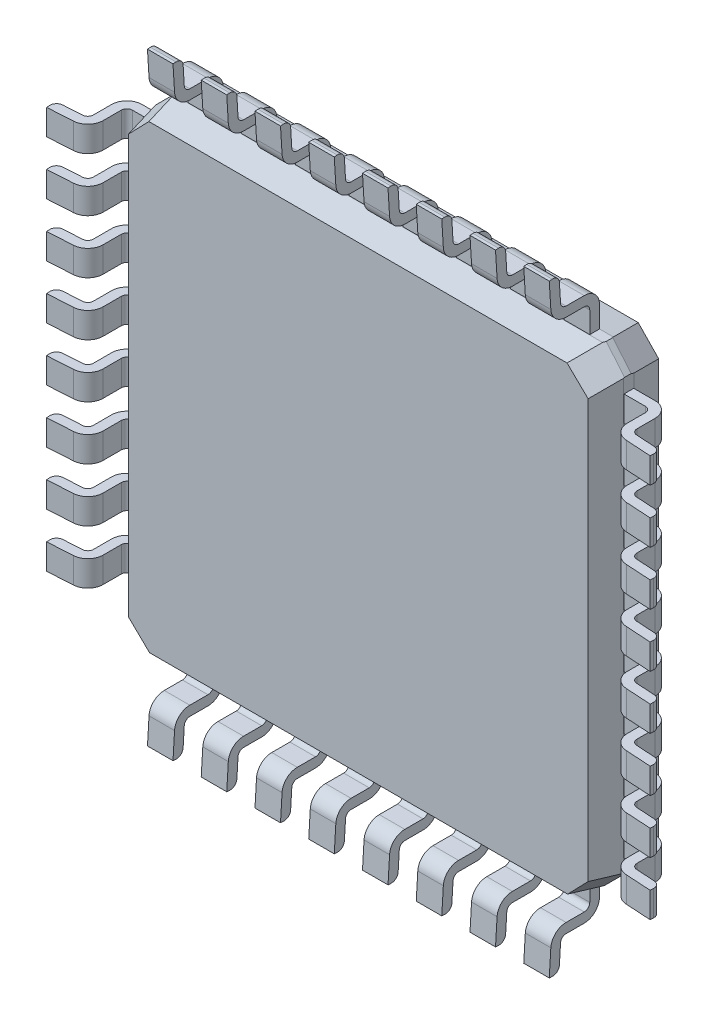
from build123d import *

# Parameters (mm, degrees)
SZKIC1_W                    = 7
SZKIC1_H                    = 7
DODANIE_WYCI_GNI_CIE1_DEPTH = 0.15
DODANIE_WYCI_GNI_CIE2_DEPTH = 0.38
ZAOKR_GLENIE1_R             = 0.1
SZYK_LINIOWY1_COUNT         = 8
SZYK_LINIOWY1_PITCH         = 0.8
SZYK_KO_OWY1_COUNT          = 4
SZKIC4_W                    = 7
SZKIC4_H                    = 7
DODANIE_WYCI_GNI_CIE3_DEPTH = 0.45
DODANIE_WYCI_GNI_CIE3_TAPER = 10
SZKIC5_W                    = 7
SZKIC5_H                    = 7
DODANIE_WYCI_GNI_CIE4_DEPTH = 0.45
DODANIE_WYCI_GNI_CIE4_TAPER = 10
SFAZOWANIE1_START           = -1
SFAZOWANIE1_DEPTH           = 2
SFAZOWANIE1_2_DEPTH         = 2
SFAZOWANIE1_3_DEPTH         = 2
SFAZOWANIE1_4_DEPTH         = 2


with BuildPart() as part:
    # Szkic1 → Dodanie-wyciągnięcie1 (new body)
    with BuildSketch(Plane.XY):
        Rectangle(SZKIC1_W, SZKIC1_H)
    extrude(amount=DODANIE_WYCI_GNI_CIE1_DEPTH)

    # Szkic4 → Dodanie-wyciągnięcie3 (add)
    with BuildSketch(Plane(origin=(0, 0, 0), x_dir=(-1, 0, 0), z_dir=(0, 0, -1))):
        Rectangle(SZKIC4_W, SZKIC4_H)
    extrude(amount=DODANIE_WYCI_GNI_CIE3_DEPTH, taper=DODANIE_WYCI_GNI_CIE3_TAPER)

    # Szkic5 → Dodanie-wyciągnięcie4 (add)
    with BuildSketch(Plane.XY.offset(0.15)):
        Rectangle(SZKIC5_W, SZKIC5_H)
    extrude(amount=DODANIE_WYCI_GNI_CIE4_DEPTH, taper=DODANIE_WYCI_GNI_CIE4_TAPER)

    # Sfazowanie1: read off the stored shape, not the designer's step
    # Sfazowanie1 outline → Sfazowanie1 (cut)
    with BuildSketch(Plane(origin=(0, 0, 0), x_dir=(0.7084735708152958, -0.7030116859307268, 0.06196586883971731), z_dir=(0.7057373445243096, 0.7057373445243087, -0.06220611776628832)).offset(SFAZOWANIE1_START)):
        Polygon((4.73009601, 0.268091231), (4.736150091, 0.170768312), (4.644562044, -0.32491832), (4.335057107, -2), (6, -2), (6, 2), (4.181114647, 2), (4.577782284, 0.748605681), align=None)
    extrude(amount=SFAZOWANIE1_DEPTH, mode=Mode.SUBTRACT)

    # Sfazowanie1 2 outline → Sfazowanie1 2 (cut)
    with BuildSketch(Plane(origin=(0, 0, 0), x_dir=(0.7084735708152958, 0.7030116859307268, 0.06196586883971731), z_dir=(0.7057373445243096, -0.7057373445243087, -0.06220611776628832)).offset(SFAZOWANIE1_START)):
        Polygon((-4.72685521, 0.320188991), (-4.720801129, 0.417511909), (-4.568487403, 0.898026359), (-4.219183212, 2), (-6, 2), (-6, -2), (-4.298153765, -2), (-4.635267164, -0.175497642), align=None)
    extrude(amount=SFAZOWANIE1_2_DEPTH, mode=Mode.SUBTRACT)

    # Sfazowanie1 3 outline → Sfazowanie1 3 (cut)
    with BuildSketch(Plane(origin=(0, 0, 0), x_dir=(0.7084735708152969, -0.703011685930725, -0.061965868839722583), z_dir=(0.7057373445243084, 0.7057373445243094, 0.06220611776629384)).offset(SFAZOWANIE1_START)):
        Polygon((-4.736150091, 0.170768312), (-4.73009601, 0.268091231), (-4.577782284, 0.748605681), (-4.181114647, 2), (-6, 2), (-6, -2), (-4.335057107, -2), (-4.644562044, -0.32491832), align=None)
    extrude(amount=SFAZOWANIE1_3_DEPTH, mode=Mode.SUBTRACT)

    # Sfazowanie1 4 outline → Sfazowanie1 4 (cut)
    with BuildSketch(Plane(origin=(0, 0, 0), x_dir=(0.7084735708152965, 0.7030116859307259, -0.06196586883971996), z_dir=(0.7057373445243089, -0.7057373445243089, 0.0622061177662911)).offset(SFAZOWANIE1_START)):
        Polygon((4.720801129, 0.417511909), (4.72685521, 0.320188991), (4.635267164, -0.175497642), (4.298153765, -2), (6, -2), (6, 2), (4.219183212, 2), (4.568487403, 0.898026359), align=None)
    extrude(amount=SFAZOWANIE1_4_DEPTH, mode=Mode.SUBTRACT)


with BuildPart() as body_2:
    # Szkic2 → Dodanie-wyciągnięcie2 (new body)
    with BuildSketch(Plane(origin=(0, 2.99, 0), x_dir=(1, 0, 0), z_dir=(0, 1, 0))):
        with BuildLine():
            Line((3.5, 0), (3.5, -0.145))
            Line((3.5, -0.145), (3.817677301, -0.145))
            ThreePointArc((3.817677301, -0.145), (3.87588824, -0.16911176), (3.9, -0.227322699))
            Line((3.9, -0.227322699), (3.9, -0.4975))
            ThreePointArc((3.9, -0.4975), (3.961747444, -0.653257646), (4.11344498, -0.724398696))
            Line((4.11344498, -0.724398696), (4.491147962, -0.7475))
            Line((4.491147962, -0.7475), (4.5, -0.602770454))
            Line((4.5, -0.602770454), (4.122297018, -0.57966915))
            ThreePointArc((4.122297018, -0.57966915), (4.067361235, -0.553906113), (4.045, -0.4975))
            Line((4.045, -0.4975), (4.045, -0.227322699))
            ThreePointArc((4.045, -0.227322699), (3.978418723, -0.066581277), (3.817677301, 0))
            Line((3.817677301, 0), (3.5, 0))
        make_face()
    extrude(amount=-DODANIE_WYCI_GNI_CIE2_DEPTH)

    # Zaokrąglenie1
    zaokr_glenie1_edges = [body_2.edges().sort_by_distance(p)[0] for p in [
        (4.5, 2.8, 0.602770454),
    ]]
    fillet(zaokr_glenie1_edges, radius=ZAOKR_GLENIE1_R)


with BuildPart() as szyk_liniowy1_1:
    # Szyk liniowy1: pattern copy
    add(body_2.part.moved(Location(Vector(0, -1, 0) * (1 * SZYK_LINIOWY1_PITCH))))


with BuildPart() as szyk_liniowy1_2:
    # Szyk liniowy1: pattern copy
    add(body_2.part.moved(Location(Vector(0, -1, 0) * (2 * SZYK_LINIOWY1_PITCH))))


with BuildPart() as szyk_liniowy1_3:
    # Szyk liniowy1: pattern copy
    add(body_2.part.moved(Location(Vector(0, -1, 0) * (3 * SZYK_LINIOWY1_PITCH))))


with BuildPart() as szyk_liniowy1_4:
    # Szyk liniowy1: pattern copy
    add(body_2.part.moved(Location(Vector(0, -1, 0) * (4 * SZYK_LINIOWY1_PITCH))))


with BuildPart() as szyk_liniowy1_5:
    # Szyk liniowy1: pattern copy
    add(body_2.part.moved(Location(Vector(0, -1, 0) * (5 * SZYK_LINIOWY1_PITCH))))


with BuildPart() as szyk_liniowy1_6:
    # Szyk liniowy1: pattern copy
    add(body_2.part.moved(Location(Vector(0, -1, 0) * (6 * SZYK_LINIOWY1_PITCH))))


with BuildPart() as szyk_liniowy1_7:
    # Szyk liniowy1: pattern copy
    add(body_2.part.moved(Location(Vector(0, -1, 0) * (7 * SZYK_LINIOWY1_PITCH))))


with BuildPart() as szyk_ko_owy1_1:
    # Szyk kołowy1: pattern copy
    add(szyk_liniowy1_7.part.rotate(Axis((0, 0, 0), (0, 0, 1)), 1 * 360 / SZYK_KO_OWY1_COUNT))


with BuildPart() as szyk_ko_owy1_2:
    # Szyk kołowy1: pattern copy
    add(szyk_liniowy1_7.part.rotate(Axis((0, 0, 0), (0, 0, 1)), 2 * 360 / SZYK_KO_OWY1_COUNT))


with BuildPart() as szyk_ko_owy1_3:
    # Szyk kołowy1: pattern copy
    add(szyk_liniowy1_7.part.rotate(Axis((0, 0, 0), (0, 0, 1)), 3 * 360 / SZYK_KO_OWY1_COUNT))


with BuildPart() as szyk_ko_owy1_4:
    # Szyk kołowy1: pattern copy
    add(szyk_liniowy1_6.part.rotate(Axis((0, 0, 0), (0, 0, 1)), 1 * 360 / SZYK_KO_OWY1_COUNT))


with BuildPart() as szyk_ko_owy1_5:
    # Szyk kołowy1: pattern copy
    add(szyk_liniowy1_6.part.rotate(Axis((0, 0, 0), (0, 0, 1)), 2 * 360 / SZYK_KO_OWY1_COUNT))


with BuildPart() as szyk_ko_owy1_6:
    # Szyk kołowy1: pattern copy
    add(szyk_liniowy1_6.part.rotate(Axis((0, 0, 0), (0, 0, 1)), 3 * 360 / SZYK_KO_OWY1_COUNT))


with BuildPart() as szyk_ko_owy1_7:
    # Szyk kołowy1: pattern copy
    add(szyk_liniowy1_5.part.rotate(Axis((0, 0, 0), (0, 0, 1)), 1 * 360 / SZYK_KO_OWY1_COUNT))


with BuildPart() as szyk_ko_owy1_8:
    # Szyk kołowy1: pattern copy
    add(szyk_liniowy1_5.part.rotate(Axis((0, 0, 0), (0, 0, 1)), 2 * 360 / SZYK_KO_OWY1_COUNT))


with BuildPart() as szyk_ko_owy1_9:
    # Szyk kołowy1: pattern copy
    add(szyk_liniowy1_5.part.rotate(Axis((0, 0, 0), (0, 0, 1)), 3 * 360 / SZYK_KO_OWY1_COUNT))


with BuildPart() as szyk_ko_owy1_10:
    # Szyk kołowy1: pattern copy
    add(szyk_liniowy1_4.part.rotate(Axis((0, 0, 0), (0, 0, 1)), 1 * 360 / SZYK_KO_OWY1_COUNT))


with BuildPart() as szyk_ko_owy1_11:
    # Szyk kołowy1: pattern copy
    add(szyk_liniowy1_4.part.rotate(Axis((0, 0, 0), (0, 0, 1)), 2 * 360 / SZYK_KO_OWY1_COUNT))


with BuildPart() as szyk_ko_owy1_12:
    # Szyk kołowy1: pattern copy
    add(szyk_liniowy1_4.part.rotate(Axis((0, 0, 0), (0, 0, 1)), 3 * 360 / SZYK_KO_OWY1_COUNT))


with BuildPart() as szyk_ko_owy1_13:
    # Szyk kołowy1: pattern copy
    add(szyk_liniowy1_3.part.rotate(Axis((0, 0, 0), (0, 0, 1)), 1 * 360 / SZYK_KO_OWY1_COUNT))


with BuildPart() as szyk_ko_owy1_14:
    # Szyk kołowy1: pattern copy
    add(szyk_liniowy1_3.part.rotate(Axis((0, 0, 0), (0, 0, 1)), 2 * 360 / SZYK_KO_OWY1_COUNT))


with BuildPart() as szyk_ko_owy1_15:
    # Szyk kołowy1: pattern copy
    add(szyk_liniowy1_3.part.rotate(Axis((0, 0, 0), (0, 0, 1)), 3 * 360 / SZYK_KO_OWY1_COUNT))


with BuildPart() as szyk_ko_owy1_16:
    # Szyk kołowy1: pattern copy
    add(szyk_liniowy1_2.part.rotate(Axis((0, 0, 0), (0, 0, 1)), 1 * 360 / SZYK_KO_OWY1_COUNT))


with BuildPart() as szyk_ko_owy1_17:
    # Szyk kołowy1: pattern copy
    add(szyk_liniowy1_2.part.rotate(Axis((0, 0, 0), (0, 0, 1)), 2 * 360 / SZYK_KO_OWY1_COUNT))


with BuildPart() as szyk_ko_owy1_18:
    # Szyk kołowy1: pattern copy
    add(szyk_liniowy1_2.part.rotate(Axis((0, 0, 0), (0, 0, 1)), 3 * 360 / SZYK_KO_OWY1_COUNT))


with BuildPart() as szyk_ko_owy1_19:
    # Szyk kołowy1: pattern copy
    add(szyk_liniowy1_1.part.rotate(Axis((0, 0, 0), (0, 0, 1)), 1 * 360 / SZYK_KO_OWY1_COUNT))


with BuildPart() as szyk_ko_owy1_20:
    # Szyk kołowy1: pattern copy
    add(szyk_liniowy1_1.part.rotate(Axis((0, 0, 0), (0, 0, 1)), 2 * 360 / SZYK_KO_OWY1_COUNT))


with BuildPart() as szyk_ko_owy1_21:
    # Szyk kołowy1: pattern copy
    add(szyk_liniowy1_1.part.rotate(Axis((0, 0, 0), (0, 0, 1)), 3 * 360 / SZYK_KO_OWY1_COUNT))


with BuildPart() as szyk_ko_owy1_22:
    # Szyk kołowy1: pattern copy
    add(body_2.part.rotate(Axis((0, 0, 0), (0, 0, 1)), 1 * 360 / SZYK_KO_OWY1_COUNT))


with BuildPart() as szyk_ko_owy1_23:
    # Szyk kołowy1: pattern copy
    add(body_2.part.rotate(Axis((0, 0, 0), (0, 0, 1)), 2 * 360 / SZYK_KO_OWY1_COUNT))


with BuildPart() as szyk_ko_owy1_24:
    # Szyk kołowy1: pattern copy
    add(body_2.part.rotate(Axis((0, 0, 0), (0, 0, 1)), 3 * 360 / SZYK_KO_OWY1_COUNT))


solid = Compound([part.part, body_2.part, szyk_liniowy1_1.part, szyk_liniowy1_2.part, szyk_liniowy1_3.part, szyk_liniowy1_4.part, szyk_liniowy1_5.part, szyk_liniowy1_6.part, szyk_liniowy1_7.part, szyk_ko_owy1_1.part, szyk_ko_owy1_2.part, szyk_ko_owy1_3.part, szyk_ko_owy1_4.part, szyk_ko_owy1_5.part, szyk_ko_owy1_6.part, szyk_ko_owy1_7.part, szyk_ko_owy1_8.part, szyk_ko_owy1_9.part, szyk_ko_owy1_10.part, szyk_ko_owy1_11.part, szyk_ko_owy1_12.part, szyk_ko_owy1_13.part, szyk_ko_owy1_14.part, szyk_ko_owy1_15.part, szyk_ko_owy1_16.part, szyk_ko_owy1_17.part, szyk_ko_owy1_18.part, szyk_ko_owy1_19.part, szyk_ko_owy1_20.part, szyk_ko_owy1_21.part, szyk_ko_owy1_22.part, szyk_ko_owy1_23.part, szyk_ko_owy1_24.part])
